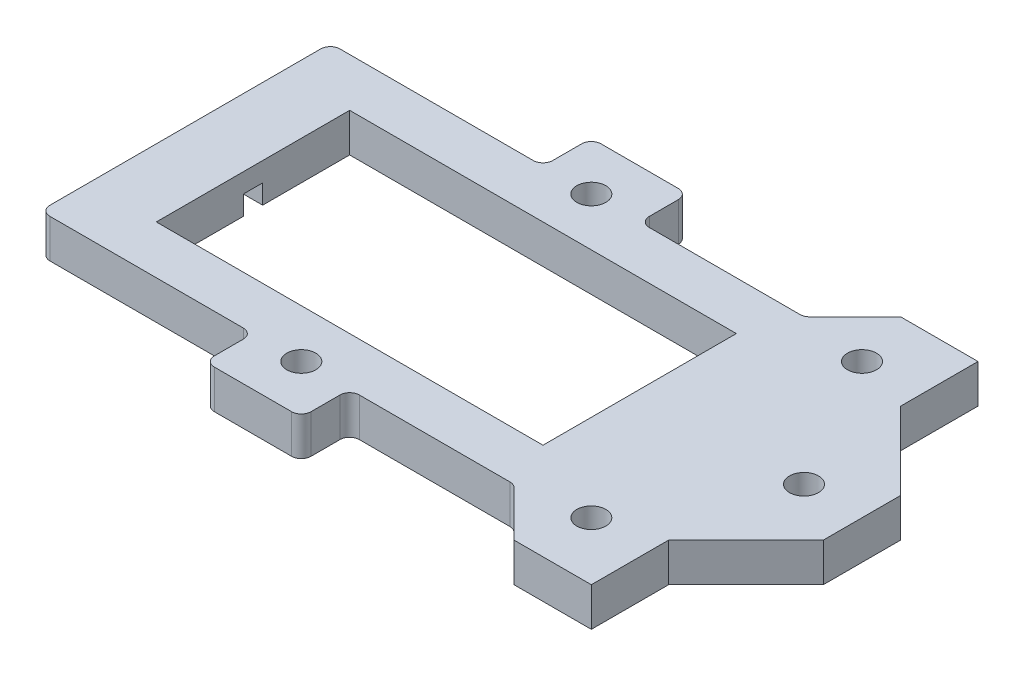
from build123d import *

# Parameters (mm, degrees)
SKETCH_1_W          = 40
SKETCH_1_H          = 20
EXTRUDE_1_DEPTH     = 4
SKETCH_2_R          = 1.5
CUT_EXTRUDE_1_DEPTH = 48.592016137
SKETCH_3_W          = 7
SKETCH_3_H          = 2
CUT_EXTRUDE_2_DEPTH = 2
FILLET_1_R          = 1


with BuildPart() as part:
    # 草图1 → 凸台-拉伸1 (new body)
    with BuildSketch(Plane(origin=(0, 0, 0), x_dir=(1, 0, 0), z_dir=(0, 1, 0))):
        Polygon((-27, 15), (-27, -15), (-5, -15), (-5, -20), (5, -20), (5, -15), (22, -15), (27, -20), (35, -20), (35, -12), (43, -4), (43, 4), (35, 12), (35, 20), (27, 20), (22, 15), (5, 15), (5, 20), (-5, 20), (-5, 15), align=None)
        Rectangle(SKETCH_1_W, SKETCH_1_H, mode=Mode.SUBTRACT)
    extrude(amount=EXTRUDE_1_DEPTH)

    # 草图2 → 切除-拉伸1 (cut, through all)
    with BuildSketch(Plane(origin=(0, 4, 0), x_dir=(1, 0, 0), z_dir=(0, 1, 0))):
        with Locations((0, 15)):
            Circle(SKETCH_2_R)
        with Locations((0, -15)):
            Circle(SKETCH_2_R)
        with Locations((29, 14)):
            Circle(SKETCH_2_R)
        with Locations((29, -14)):
            Circle(SKETCH_2_R)
        with Locations((37, 0)):
            Circle(SKETCH_2_R)
    extrude(amount=-CUT_EXTRUDE_1_DEPTH, mode=Mode.SUBTRACT)

    # 草图3 → 切除-拉伸2 (cut)
    with BuildSketch(Plane.XZ):
        with Locations((-23.5, 0)):
            Rectangle(SKETCH_3_W, SKETCH_3_H)
        with Locations((23.5, 0)):
            Rectangle(SKETCH_3_W, SKETCH_3_H)
    extrude(amount=-CUT_EXTRUDE_2_DEPTH, mode=Mode.SUBTRACT)

    # 圆角1
    fillet_1_edges = [part.edges().sort_by_distance(p)[0] for p in [
        (-5, 2, -15),
        (-5, 2, -20),
        (5, 2, -20),
        (5, 2, -15),
        (22, 2, -15),
        (22, 2, 15),
        (5, 2, 15),
        (5, 2, 20),
        (-5, 2, 20),
        (-5, 2, 15),
        (-27, 2, 15),
        (-27, 2, -15),
    ]]
    fillet(fillet_1_edges, radius=FILLET_1_R)


solid = part.part
